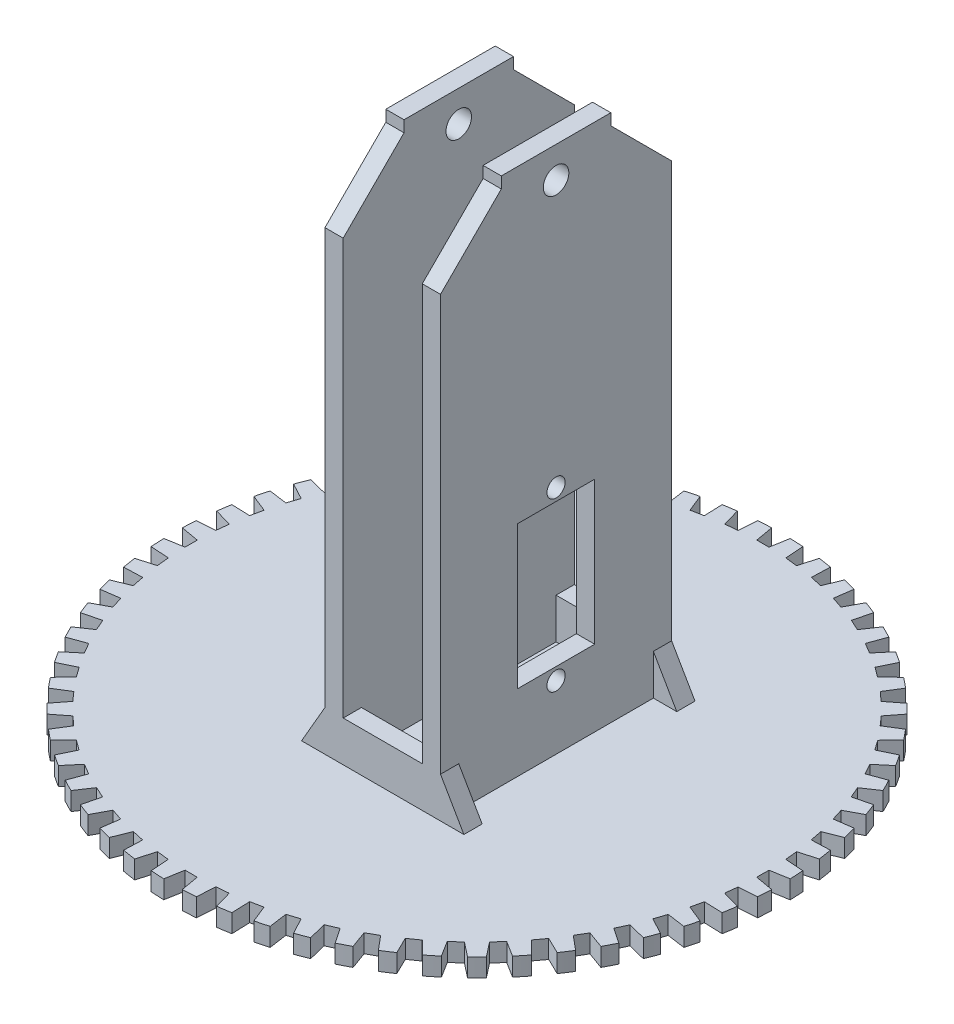
from build123d import *

# Parameters (mm, degrees)
SKETCH_1_R               = 50
EXTRUDE_1_DEPTH          = 3
CUT_EXTRUDE_START        = -3
CUT_EXTRUDE_1_DEPTH      = 3
PATTERN_CIRCULAR_1_COUNT = 60
SKETCH_3_R               = 1.8
CUT_EXTRUDE_2_DEPTH      = 3
SKETCH_4_W               = 3
SKETCH_4_H               = 38
EXTRUDE_2_DEPTH          = 85
SKETCH_7_R               = 1.5
CUT_EXTRUDE_3_DEPTH      = 5
CHAMFER_1_SIZE           = 10
SKETCH_9_W               = 3
SKETCH_9_H               = 18
EXTRUDE_3_DEPTH          = 3
SKETCH_10_W              = 3
SKETCH_10_H              = 38
EXTRUDE_4_DEPTH          = 85
CHAMFER_2_SIZE           = 10
SKETCH_11_W              = 3
SKETCH_11_H              = 18
EXTRUDE_5_DEPTH          = 3
SKETCH_8_R               = 2.1
CUT_EXTRUDE_5_DEPTH      = 39
EXTRUDE_6_DEPTH          = 3
SKETCH_17_W              = 18
SKETCH_17_H              = 1.14
CUT_EXTRUDE_6_DEPTH      = 25
SKETCH_18_W              = 12.7
SKETCH_18_H              = 23.5
CUT_EXTRUDE_7_DEPTH      = 10


with BuildPart() as part:
    # Эскиз1 → Бобышка-Вытянуть1 (new body)
    with BuildSketch(Plane(origin=(0, 0, 0), x_dir=(1, 0, 0), z_dir=(0, 1, 0))):
        Circle(SKETCH_1_R)
    extrude(amount=EXTRUDE_1_DEPTH)

    # Эскиз2 → Вырез-Вытянуть1 (cut)
    with BuildSketch(Plane(origin=(0, 3, 0), x_dir=(1, 0, 0), z_dir=(0, 1, 0)).offset(CUT_EXTRUDE_START)):
        with BuildLine():
            Line((-1, 47.010639502), (1, 46.989360498))
            Line((1, 46.989360498), (1.526745916, 49.976685033))
            ThreePointArc((1.526745916, 49.976685033), (0.001866861, 49.999999965), (-1.523013931, 49.976798903))
            Line((-1.523013931, 49.976798903), (-1, 47.010639502))
        make_face()
    cut_extrude_1 = extrude(amount=CUT_EXTRUDE_1_DEPTH, mode=Mode.SUBTRACT)

    # Круговой массив1: Вырез-Вытянуть1 ×60 about axis
    pattern_circular_1_axis = Axis((0, 3, 0), (0, 1, 0))
    for i in range(1, PATTERN_CIRCULAR_1_COUNT):
        add(cut_extrude_1.rotate(pattern_circular_1_axis, i * 360 / PATTERN_CIRCULAR_1_COUNT), mode=Mode.SUBTRACT)

    # Эскиз3 → Вырез-Вытянуть2 (cut)
    with BuildSketch(Plane(origin=(0, 3, 0), x_dir=(1, 0, 0), z_dir=(0, 1, 0))):
        Circle(SKETCH_3_R)
    extrude(amount=-CUT_EXTRUDE_2_DEPTH, mode=Mode.SUBTRACT)

    # Эскиз4 → Бобышка-Вытянуть2 (add)
    with BuildSketch(Plane(origin=(0, 3, 0), x_dir=(1, 0, 0), z_dir=(0, 1, 0))):
        with Locations((11.5, 0)):
            Rectangle(SKETCH_4_W, SKETCH_4_H)
    extrude(amount=EXTRUDE_2_DEPTH)

    # Эскиз7 → Вырез-Вытянуть3 (cut)
    with BuildSketch(Plane(origin=(13, 0, 0), x_dir=(0, 0, -1), z_dir=(1, 0, 0))):
        with Locations((0, 13.5)):
            Circle(SKETCH_7_R)
        with Locations((0, 41)):
            Circle(SKETCH_7_R)
    extrude(amount=-CUT_EXTRUDE_3_DEPTH, mode=Mode.SUBTRACT)

    # Фаска1
    chamfer_1_edges = [part.edges().sort_by_distance(p)[0] for p in [
        (11.5, 88, -19),
        (11.5, 88, 19),
    ]]
    chamfer(chamfer_1_edges, length=CHAMFER_1_SIZE)

    # Эскиз9 → Бобышка-Вытянуть3 (add)
    with BuildSketch(Plane(origin=(0, 88, 0), x_dir=(1, 0, 0), z_dir=(0, 1, 0))):
        with Locations((11.5, 0)):
            Rectangle(SKETCH_9_W, SKETCH_9_H)
    extrude(amount=EXTRUDE_3_DEPTH)

    # Эскиз10 → Бобышка-Вытянуть4 (add)
    with BuildSketch(Plane(origin=(0, 3, 0), x_dir=(1, 0, 0), z_dir=(0, 1, 0))):
        with Locations((-4.5, 0)):
            Rectangle(SKETCH_10_W, SKETCH_10_H)
    extrude(amount=EXTRUDE_4_DEPTH)

    # Фаска2
    chamfer_2_edges = [part.edges().sort_by_distance(p)[0] for p in [
        (-4.5, 88, -19),
        (-4.5, 88, 19),
    ]]
    chamfer(chamfer_2_edges, length=CHAMFER_2_SIZE)

    # Эскиз11 → Бобышка-Вытянуть5 (add)
    with BuildSketch(Plane(origin=(0, 88, 0), x_dir=(1, 0, 0), z_dir=(0, 1, 0))):
        with Locations((-4.5, 0)):
            Rectangle(SKETCH_11_W, SKETCH_11_H)
    extrude(amount=EXTRUDE_5_DEPTH)

    # Эскиз8 → Вырез-Вытянуть5 (cut)
    with BuildSketch(Plane(origin=(13, 0, 0), x_dir=(0, 0, -1), z_dir=(1, 0, 0))):
        with Locations((0, 84.75)):
            Circle(SKETCH_8_R)
    extrude(amount=-CUT_EXTRUDE_5_DEPTH, mode=Mode.SUBTRACT)

    # Эскиз16 → Бобышка-Вытянуть6 (add)
    with BuildSketch(Plane.XY.offset(19)):
        Polygon((-6, 9.66330056), (13, 9.66330056), (16.847058372, 3), (13, 3), (-6, 3), (-9.847058372, 3), align=None)
    extrude_6 = extrude(amount=-EXTRUDE_6_DEPTH)

    # Зеркальное отражение1: Бобышка-Вытянуть6 across plane
    add(extrude_6.mirror(Plane.XY))

    # Эскиз17 → Вырез-Вытянуть6 (cut)
    with BuildSketch(Plane.ZY.offset(6)):
        with Locations((0, 90.43)):
            Rectangle(SKETCH_17_W, SKETCH_17_H)
    extrude(amount=-CUT_EXTRUDE_6_DEPTH, mode=Mode.SUBTRACT)

    # Эскиз18 → Вырез-Вытянуть7 (cut)
    with BuildSketch(Plane(origin=(13, 0, 0), x_dir=(0, 0, -1), z_dir=(1, 0, 0))):
        with Locations((0, 27.25)):
            Rectangle(SKETCH_18_W, SKETCH_18_H)
    extrude(amount=-CUT_EXTRUDE_7_DEPTH, mode=Mode.SUBTRACT)


solid = part.part
